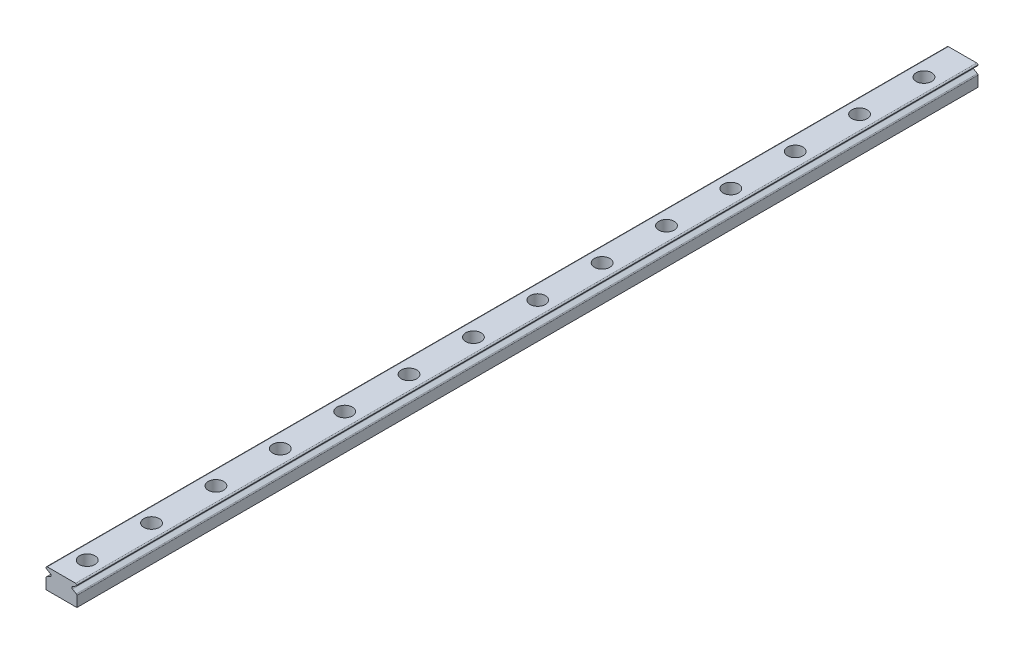
from build123d import *

# Parameters (mm, degrees)
BOSS_EXTRUDE2_DEPTH = 400
FILLET5_R           = 0.5
SKETCH3_R           = 3
CUT_EXTRUDE2_DEPTH  = 4.5
SKETCH4_R           = 1.75
CUT_EXTRUDE3_DEPTH  = 14.5
SKETCH5_W           = 12
SKETCH5_H           = 4.057387372
CUT_EXTRUDE4_DEPTH  = 682.5
SKETCH6_W           = 13.958482149
SKETCH6_H           = 9.545138528
CUT_EXTRUDE5_DEPTH  = 50


with BuildPart() as part:
    # Sketch1 → Boss-Extrude2 (new body)
    with BuildSketch(Plane.XY):
        Polygon((0, 0), (12, 0), (12, 8.403449878), (9.5, 9.846825551), (12, 11.290201224), (12, 12), (0, 12), (0, 11.290201224), (2.5, 9.846825551), (0, 8.403449878), align=None)
    extrude(amount=BOSS_EXTRUDE2_DEPTH)

    # Fillet5
    # the kernel refuses this fillet: 0.5 mm, written as the material it adds along each edge
    with BuildSketch(Plane(origin=(2.5, 9.846825551, 0), x_dir=(-0.8660254037844382, 0.5000000000000009, 0), z_dir=(0, 0, 1)), Plane(origin=(9.5, 9.846825551, 0), x_dir=(0.8660254037844379, -0.5000000000000013, 0), z_dir=(0, 0, 1))) as fillet5_piece_1:
        with BuildLine():
            CenterArc((FILLET5_R * 1.73205080757, FILLET5_R), FILLET5_R, 150, 120)
            Line((FILLET5_R * 0.866025403784, FILLET5_R * 1.5), (0, 0))
            Line((0, 0), (FILLET5_R * 1.73205080757, 0))
        make_face()
    extrude(amount=400)
    # the kernel refuses this fillet: 0.5 mm, written as the material it takes off along each edge
    with BuildSketch(Plane(origin=(0, 8.403449878, -0.721687836), x_dir=(0, -1, 0), z_dir=(0, 0, 1))) as fillet5_2_piece_1:
        with BuildLine():
            CenterArc((FILLET5_R * 0.57735026919, FILLET5_R), FILLET5_R, 210, 60)
            Line((-FILLET5_R * 0.288675134595, FILLET5_R * 0.5), (0, 0))
            Line((0, 0), (FILLET5_R * 0.57735026919, 0))
        make_face()
    extrude(amount=401.443375673, mode=Mode.SUBTRACT)
    with BuildSketch(Plane(origin=(0, 11.290201224, -0.721687836), x_dir=(0, 1, 0), z_dir=(0, 0, 1)), Plane(origin=(12, 11.290201224, -0.721687836), x_dir=(-0.8660254037844355, -0.5000000000000052, 0), z_dir=(0, 0, 1)), Plane(origin=(12, 8.403449878, -0.721687836), x_dir=(0, -1, 0), z_dir=(0, 0, 1))) as fillet5_2_piece_2:
        with BuildLine():
            CenterArc((FILLET5_R * 0.57735026919, -FILLET5_R), FILLET5_R, 90, 60)
            Line((-FILLET5_R * 0.288675134595, -FILLET5_R * 0.5), (0, 0))
            Line((0, 0), (FILLET5_R * 0.57735026919, 0))
        make_face()
    extrude(amount=401.443375673, mode=Mode.SUBTRACT)
    with BuildSketch(Plane(origin=(0, 12, -1.25), x_dir=(1, 0, 0), z_dir=(0, 0, 1)), Plane(origin=(12, 12, -1.25), x_dir=(0, -1, 0), z_dir=(0, 0, 1))) as fillet5_2_piece_3:
        with BuildLine():
            CenterArc((FILLET5_R, -FILLET5_R), FILLET5_R, 90, 90)
            Line((0, -FILLET5_R), (0, 0))
            Line((0, 0), (FILLET5_R, 0))
        make_face()
    extrude(amount=402.5, mode=Mode.SUBTRACT)

    # Sketch3 → Cut-Extrude2 (cut)
    with BuildSketch(Plane(origin=(0, 12, 0), x_dir=(1, 0, 0), z_dir=(0, 1, 0))):
        with Locations((6, -490)):
            Circle(SKETCH3_R)
        with Locations((6, -440)):
            Circle(SKETCH3_R)
        with Locations((6, -415)):
            Circle(SKETCH3_R)
        with Locations(Location((6, -390, 0), (0, 0, 180))):
            Circle(SKETCH3_R)
        with Locations(Location((6, -365, 0), (0, 0, 180))):
            Circle(SKETCH3_R)
        with Locations(Location((6, -340, 0), (0, 0, 180))):
            Circle(SKETCH3_R)
        with Locations(Location((6, -315, 0), (0, 0, 180))):
            Circle(SKETCH3_R)
        with Locations(Location((6, -290, 0), (0, 0, 180))):
            Circle(SKETCH3_R)
        with Locations(Location((6, -265, 0), (0, 0, 180))):
            Circle(SKETCH3_R)
        with Locations(Location((6, -240, 0), (0, 0, 180))):
            Circle(SKETCH3_R)
        with Locations(Location((6, -215, 0), (0, 0, 180))):
            Circle(SKETCH3_R)
        with Locations(Location((6, -190, 0), (0, 0, 180))):
            Circle(SKETCH3_R)
        with Locations(Location((6, -165, 0), (0, 0, 180))):
            Circle(SKETCH3_R)
        with Locations(Location((6, -140, 0), (0, 0, 180))):
            Circle(SKETCH3_R)
        with Locations(Location((6, -115, 0), (0, 0, 180))):
            Circle(SKETCH3_R)
        with Locations(Location((6, -90, 0), (0, 0, 180))):
            Circle(SKETCH3_R)
        with Locations(Location((6, -65, 0), (0, 0, 180))):
            Circle(SKETCH3_R)
        with Locations(Location((6, -40, 0), (0, 0, 180))):
            Circle(SKETCH3_R)
        with Locations(Location((6, -15, 0), (0, 0, 180))):
            Circle(SKETCH3_R)
        with Locations((6, -465)):
            Circle(SKETCH3_R)
    extrude(amount=-CUT_EXTRUDE2_DEPTH, mode=Mode.SUBTRACT)

    # Sketch4 → Cut-Extrude3 (cut)
    with BuildSketch(Plane(origin=(0, 12, 0), x_dir=(1, 0, 0), z_dir=(0, 1, 0))):
        with Locations(Location((6, -15, 0), (0, 0, 180))):
            Circle(SKETCH4_R)
        with Locations(Location((6, -40, 0), (0, 0, 180))):
            Circle(SKETCH4_R)
        with Locations(Location((6, -65, 0), (0, 0, 180))):
            Circle(SKETCH4_R)
        with Locations(Location((6, -90, 0), (0, 0, 180))):
            Circle(SKETCH4_R)
        with Locations(Location((6, -115, 0), (0, 0, 180))):
            Circle(SKETCH4_R)
        with Locations(Location((6, -140, 0), (0, 0, 180))):
            Circle(SKETCH4_R)
        with Locations(Location((6, -165, 0), (0, 0, 180))):
            Circle(SKETCH4_R)
        with Locations(Location((6, -190, 0), (0, 0, 180))):
            Circle(SKETCH4_R)
        with Locations(Location((6, -215, 0), (0, 0, 180))):
            Circle(SKETCH4_R)
        with Locations(Location((6, -240, 0), (0, 0, 180))):
            Circle(SKETCH4_R)
        with Locations(Location((6, -265, 0), (0, 0, 180))):
            Circle(SKETCH4_R)
        with Locations(Location((6, -290, 0), (0, 0, 180))):
            Circle(SKETCH4_R)
        with Locations(Location((6, -315, 0), (0, 0, 180))):
            Circle(SKETCH4_R)
        with Locations(Location((6, -340, 0), (0, 0, 180))):
            Circle(SKETCH4_R)
        with Locations(Location((6, -365, 0), (0, 0, 180))):
            Circle(SKETCH4_R)
        with Locations(Location((6, -390, 0), (0, 0, 180))):
            Circle(SKETCH4_R)
        with Locations((6, -415)):
            Circle(SKETCH4_R)
        with Locations((6, -440)):
            Circle(SKETCH4_R)
        with Locations((6, -465)):
            Circle(SKETCH4_R)
        with Locations((6, -490)):
            Circle(SKETCH4_R)
    extrude(amount=-CUT_EXTRUDE3_DEPTH, mode=Mode.SUBTRACT)

    # Sketch5 → Cut-Extrude4 (cut)
    with BuildSketch(Plane(origin=(0, 0, 0), x_dir=(-1, 0, 0), z_dir=(0, 0, -1))):
        with Locations((-6, 2.028693686)):
            Rectangle(SKETCH5_W, SKETCH5_H)
    extrude(amount=-CUT_EXTRUDE4_DEPTH, mode=Mode.SUBTRACT)

    # Sketch6 → Cut-Extrude5 (cut)
    with BuildSketch(Plane.XY.offset(400)):
        with Locations((6.153953848, 7.847446167)):
            Rectangle(SKETCH6_W, SKETCH6_H)
    extrude(amount=-CUT_EXTRUDE5_DEPTH, mode=Mode.SUBTRACT)


solid = part.part
